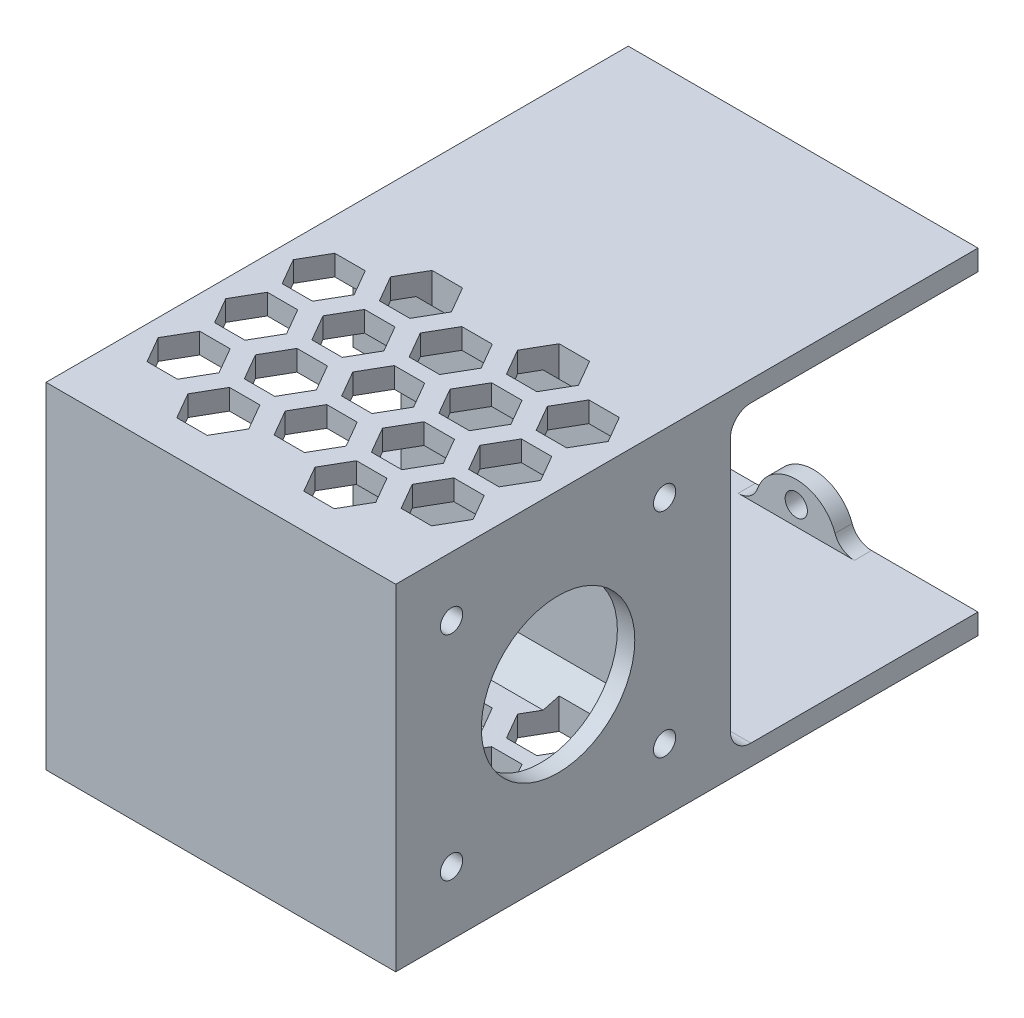
from build123d import *

# Parameters (mm, degrees)
BOSS_EXTRUDE1_DEPTH = 84.985
SKETCH2_W           = 4
SKETCH2_H           = 43
BOSS_EXTRUDE2_DEPTH = 48.05
SKETCH9_W           = 2.54
SKETCH9_H           = 43
BOSS_EXTRUDE5_DEPTH = 48.05
SKETCH11_W          = 7
SKETCH11_H          = 13
CUT_EXTRUDE2_DEPTH  = 4
SKETCH13_R          = 1.625
BOSS_EXTRUDE6_DEPTH = 2.5
FILLET1_R           = 3
CHAMFER2_SIZE       = 4
CUT_EXTRUDE3_DEPTH  = 3
SKETCH20_R          = 1.625
SKETCH20_R_2        = 11.2
BOSS_EXTRUDE7_DEPTH = 2.54
SKETCH22_W          = 36.145
SKETCH22_H          = 43
CUT_EXTRUDE4_DEPTH  = 3
FILLET2_R           = 3
FILL_START          = -3
FILL_PATTERN2_DEPTH = 49


# Read off the part's stored shape, not the designer's step: Fill Pattern2
with BuildPart() as part:
    # Sketch1 → Boss-Extrude1 (new body)
    with BuildSketch(Plane.XY):
        Polygon((0, 0), (-48.05, 0), (-48.05, 43), (0, 43), (0, 46), (-51.05, 46), (-51.05, -3), (0, -3), align=None)
    extrude(amount=BOSS_EXTRUDE1_DEPTH)

    # Sketch2 → Boss-Extrude2 (add)
    with BuildSketch(Plane(origin=(-48.05, 0, 0), x_dir=(0, 0, -1), z_dir=(1, 0, 0))):
        with Locations((-38.145, 21.5)):
            Rectangle(SKETCH2_W, SKETCH2_H)
    extrude(amount=BOSS_EXTRUDE2_DEPTH)

    # Sketch9 → Boss-Extrude5 (add)
    with BuildSketch(Plane(origin=(-48.05, 0, 0), x_dir=(0, 0, -1), z_dir=(1, 0, 0))):
        with Locations((-83.715, 21.5)):
            Rectangle(SKETCH9_W, SKETCH9_H)
    extrude(amount=BOSS_EXTRUDE5_DEPTH)

    # Sketch11 → Cut-Extrude2 (cut)
    with BuildSketch(Plane.XY.offset(40.145)):
        with Locations((-47.55, 21.5)):
            Rectangle(SKETCH11_W, SKETCH11_H)
    extrude(amount=-CUT_EXTRUDE2_DEPTH, mode=Mode.SUBTRACT)

    # Sketch13 → Boss-Extrude6 (add)
    with BuildSketch(Plane.XY):
        with BuildLine():
            Line((-18.025, 43), (-30.025, 43))
            ThreePointArc((-30.025, 43), (-24.025, 37), (-18.025, 43))
        make_face()
        with Locations((-24.025, 40.2)):
            Circle(SKETCH13_R, mode=Mode.SUBTRACT)
    boss_extrude6 = extrude(amount=BOSS_EXTRUDE6_DEPTH)

    # Mirror6: Boss-Extrude6 across plane
    add(boss_extrude6.mirror(Plane.ZX.offset(21.5)))

    # Fillet1
    fillet1_edges = [part.edges().sort_by_distance(p)[0] for p in [
        (-30.025, 43, 1.25),
        (-18.025, 43, 1.25),
        (-18.025, 0, 1.25),
        (-30.025, 0, 1.25),
    ]]
    fillet(fillet1_edges, radius=FILLET1_R)

    # Chamfer2
    chamfer2_edges = [part.edges().sort_by_distance(p)[0] for p in [
        (-24.025, 0, 40.145),
        (-24.025, 43, 40.145),
        (-24.025, 0, 82.445),
        (-24.025, 43, 82.445),
    ]]
    chamfer(chamfer2_edges, length=CHAMFER2_SIZE)

    # Sketch19 → Cut-Extrude3 (cut)
    with BuildSketch(Plane(origin=(-48.05, 0, 0), x_dir=(0, 0, -1), z_dir=(1, 0, 0))):
        Polygon((-40.145, 28), (-40.145, 15), (-40.145, 4), (-44.145, 0), (-78.445, 0), (-82.445, 4), (-82.445, 39), (-78.445, 43), (-44.145, 43), (-40.145, 39), align=None)
    extrude(amount=-CUT_EXTRUDE3_DEPTH, mode=Mode.SUBTRACT)

    # Sketch20 → Boss-Extrude7 (add)
    with BuildSketch(Plane(origin=(0, 0, 0), x_dir=(0, 0, -1), z_dir=(1, 0, 0))):
        Polygon((-78.445, 43), (-44.145, 43), (-40.145, 39), (-40.145, 4), (-44.145, 0), (-78.445, 0), (-82.445, 4), (-82.445, 39), align=None)
        with Locations((-76.845, 6.234203655)):
            Circle(SKETCH20_R, mode=Mode.SUBTRACT)
        with Locations((-45.745, 6.234203655)):
            Circle(SKETCH20_R, mode=Mode.SUBTRACT)
        with Locations((-45.745, 37.334203655)):
            Circle(SKETCH20_R, mode=Mode.SUBTRACT)
        with Locations((-76.845, 37.334203655)):
            Circle(SKETCH20_R, mode=Mode.SUBTRACT)
        with Locations((-61.295, 21.5)):
            Circle(SKETCH20_R_2, mode=Mode.SUBTRACT)
    extrude(amount=-BOSS_EXTRUDE7_DEPTH)

    # Sketch22 → Cut-Extrude4 (cut)
    with BuildSketch(Plane(origin=(-48.05, 0, 0), x_dir=(0, 0, -1), z_dir=(1, 0, 0))):
        with Locations((-18.0725, 21.5)):
            Rectangle(SKETCH22_W, SKETCH22_H)
    extrude(amount=-CUT_EXTRUDE4_DEPTH, mode=Mode.SUBTRACT)

    # Fillet2
    fillet2_edges = [part.edges().sort_by_distance(p)[0] for p in [
        (-25.525, 0, 36.145),
        (-25.525, 43, 36.145),
    ]]
    fillet(fillet2_edges, radius=FILLET2_R)

    # Fill Pattern2 outline → Fill Pattern2 (cut)
    with BuildSketch(Plane(origin=(0, 0, 0), x_dir=(1, 0, 0), z_dir=(0, 1, 0)).offset(FILL_START)):
        Polygon((-30.356284668, -46.506645772), (-32.576117197, -42.661783049), (-37.015782253, -42.661783049), (-39.235614782, -46.506645772), (-37.015782253, -50.351508496), (-32.576117197, -50.351508496), align=None)
        Polygon((-14.034217747, -42.661783049), (-18.473882803, -42.661783049), (-20.693715332, -46.506645772), (-18.473882803, -50.351508496), (-14.034217747, -50.351508496), (-11.814385218, -46.506645772), align=None)
        Polygon((-21.085334943, -71.153902819), (-23.305167472, -67.309040095), (-27.744832528, -67.309040095), (-29.964665057, -71.153902819), (-27.744832528, -74.998765542), (-23.305167472, -74.998765542), align=None)
        Polygon((-41.847066922, -67.309040095), (-46.286731978, -67.309040095), (-48.506564507, -71.153902819), (-46.286731978, -74.998765542), (-41.847066922, -74.998765542), (-39.627234393, -71.153902819), align=None)
        Polygon((-4.763268022, -67.309040095), (-9.202933078, -67.309040095), (-11.422765607, -71.153902819), (-9.202933078, -74.998765542), (-4.763268022, -74.998765542), (-2.543435493, -71.153902819), align=None)
        Polygon((-21.085334943, -61.295), (-23.305167472, -57.450137277), (-27.744832528, -57.450137277), (-29.964665057, -61.295), (-27.744832528, -65.139862723), (-23.305167472, -65.139862723), align=None)
        Polygon((-41.847066922, -57.450137277), (-46.286731978, -57.450137277), (-48.506564507, -61.295), (-46.286731978, -65.139862723), (-41.847066922, -65.139862723), (-39.627234393, -61.295), align=None)
        Polygon((-4.763268022, -57.450137277), (-9.202933078, -57.450137277), (-11.422765607, -61.295), (-9.202933078, -65.139862723), (-4.763268022, -65.139862723), (-2.543435493, -61.295), align=None)
        Polygon((-30.356284668, -56.365548591), (-32.576117197, -52.520685867), (-37.015782253, -52.520685867), (-39.235614782, -56.365548591), (-37.015782253, -60.210411314), (-32.576117197, -60.210411314), align=None)
        Polygon((-14.034217747, -52.520685867), (-18.473882803, -52.520685867), (-20.693715332, -56.365548591), (-18.473882803, -60.210411314), (-14.034217747, -60.210411314), (-11.814385218, -56.365548591), align=None)
        Polygon((-11.814385218, -76.083354228), (-14.034217747, -72.238491504), (-18.473882803, -72.238491504), (-20.693715332, -76.083354228), (-18.473882803, -79.928216951), (-14.034217747, -79.928216951), align=None)
        Polygon((-32.576117197, -72.238491504), (-37.015782253, -72.238491504), (-39.235614782, -76.083354228), (-37.015782253, -79.928216951), (-32.576117197, -79.928216951), (-30.356284668, -76.083354228), align=None)
        Polygon((-30.356284668, -66.224451409), (-32.576117197, -62.379588686), (-37.015782253, -62.379588686), (-39.235614782, -66.224451409), (-37.015782253, -70.069314133), (-32.576117197, -70.069314133), align=None)
        Polygon((-14.034217747, -62.379588686), (-18.473882803, -62.379588686), (-20.693715332, -66.224451409), (-18.473882803, -70.069314133), (-14.034217747, -70.069314133), (-11.814385218, -66.224451409), align=None)
        Polygon((-2.543435493, -51.436097181), (-4.763268022, -47.591234458), (-9.202933078, -47.591234458), (-11.422765607, -51.436097181), (-9.202933078, -55.280959905), (-4.763268022, -55.280959905), align=None)
        Polygon((-41.847066922, -47.591234458), (-46.286731978, -47.591234458), (-48.506564507, -51.436097181), (-46.286731978, -55.280959905), (-41.847066922, -55.280959905), (-39.627234393, -51.436097181), align=None)
        Polygon((-23.305167472, -47.591234458), (-27.744832528, -47.591234458), (-29.964665057, -51.436097181), (-27.744832528, -55.280959905), (-23.305167472, -55.280959905), (-21.085334943, -51.436097181), align=None)
    extrude(amount=FILL_PATTERN2_DEPTH, mode=Mode.SUBTRACT)


solid = part.part
